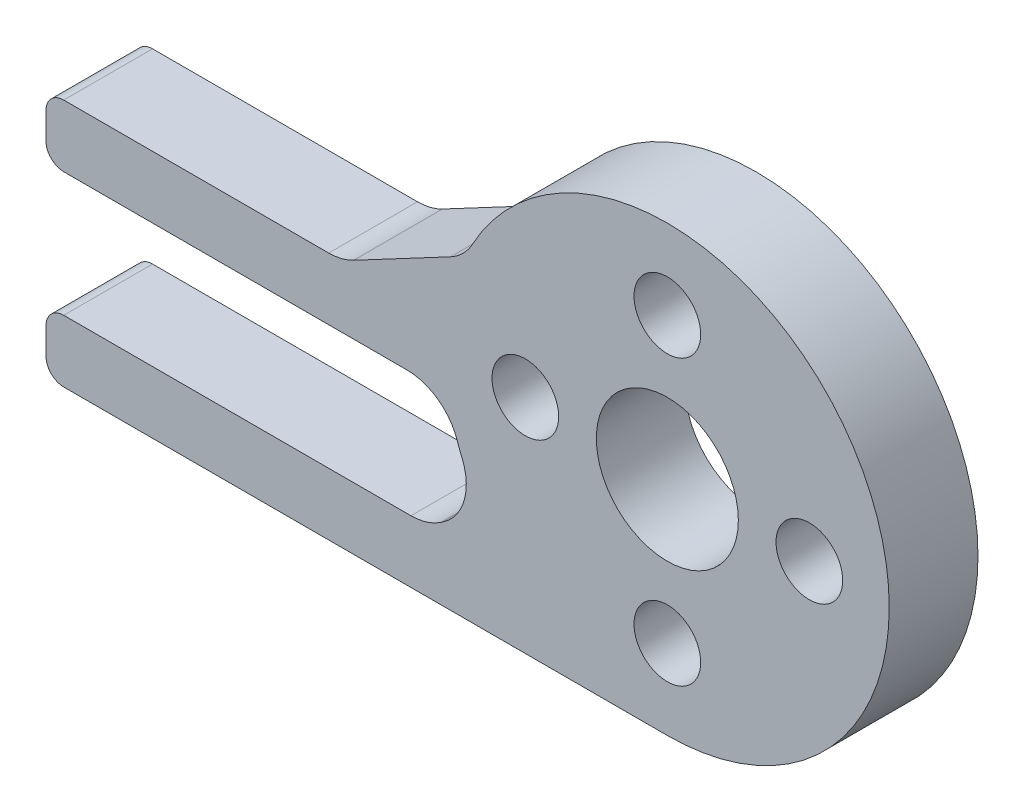
from build123d import *

# Parameters (mm, degrees)
SKETCH1_R           = 1.878
SKETCH1_R_2         = 4
BOSS_EXTRUDE1_DEPTH = 5
FILLET1_R           = 3
FILLET2_R           = 3
FILLET3_R           = 1
FILLET4_R           = 1


with BuildPart() as part:
    # Sketch1 → Boss-Extrude1 (new body)
    with BuildSketch(Plane.XY):
        with BuildLine():
            Line((0, -12.5), (-35, -12.5))
            Line((-35, -12.5), (-35, -9))
            Line((-35, -9), (-13.521844546, -9))
            Line((-13.521844546, -9), (-10.422570658, -6.900726112))
            ThreePointArc((-10.422570658, -6.900726112), (-11.641569013, -4.552347848), (-12.338962679, -2))
            Line((-12.338962679, -2), (-35, -2))
            Line((-35, -2), (-35, 1.5))
            Line((-35, 1.5), (-12.409673646, 1.5))
            ThreePointArc((-12.409673646, 1.5), (9.354143467, 8.291561976), (0, -12.5))
        make_face()
        with Locations((0, 8)):
            Circle(SKETCH1_R, mode=Mode.SUBTRACT)
        with Locations((8, 0)):
            Circle(SKETCH1_R, mode=Mode.SUBTRACT)
        with Locations((0, -8)):
            Circle(SKETCH1_R, mode=Mode.SUBTRACT)
        with Locations((-8, 0)):
            Circle(SKETCH1_R, mode=Mode.SUBTRACT)
        Circle(SKETCH1_R_2, mode=Mode.SUBTRACT)
    extrude(amount=BOSS_EXTRUDE1_DEPTH)

    # Chamfer1
    # the kernel refuses this chamfer: 6.874632774, 6 mm, written as the material it adds along each edge
    with BuildSketch(Plane(origin=(-12.409673646, 1.5, 0), x_dir=(-0.9997808942395764, -0.02093235566086501, 0), z_dir=(0, 0, 1))) as chamfer1_piece_1:
        with BuildLine():
            Line((6.161688618, 0), (-1.363052276, -3.796482939))
            Line((-1.363052276, -3.796482939), (-1.486883786, -3.736733567))
            ThreePointArc((-1.486883786, -3.736733567), (-0.576736398, -1.931017764), (-0.136123845, 0.019352752))
            Line((-0.136123845, 0.019352752), (0.002878045, 0.13746253))
            ThreePointArc((0.002878045, 0.13746253), (3.082372441, 0.072987331), (6.164566664, 0.13746253))
            Line((6.164566664, 0.13746253), (6.161688618, 0))
        make_face()
    extrude(amount=5)

    # Fillet1
    fillet1_edges = [part.edges().sort_by_distance(p)[0] for p in [
        (-13.521844546, -9, 2.5),
        (-10.422570658, -6.900726112, 2.5),
        (-12.338962679, -2, 2.5),
    ]]
    fillet(fillet1_edges, radius=FILLET1_R)

    # Fillet2
    fillet2_edges = [part.edges().sort_by_distance(p)[0] for p in [
        (-18.327151282, 1.5, 2.5),
        (-11.369250275, 5.195204345, 2.5),
    ]]
    fillet(fillet2_edges, radius=FILLET2_R)

    # Fillet3
    fillet3_edges = [part.edges().sort_by_distance(p)[0] for p in [
        (-35, -2, 2.5),
        (-35, -9, 2.5),
    ]]
    fillet(fillet3_edges, radius=FILLET3_R)

    # Fillet4
    fillet4_edges = [part.edges().sort_by_distance(p)[0] for p in [
        (-35, 1.5, 2.5),
        (-35, -12.5, 2.5),
    ]]
    fillet(fillet4_edges, radius=FILLET4_R)


solid = part.part
